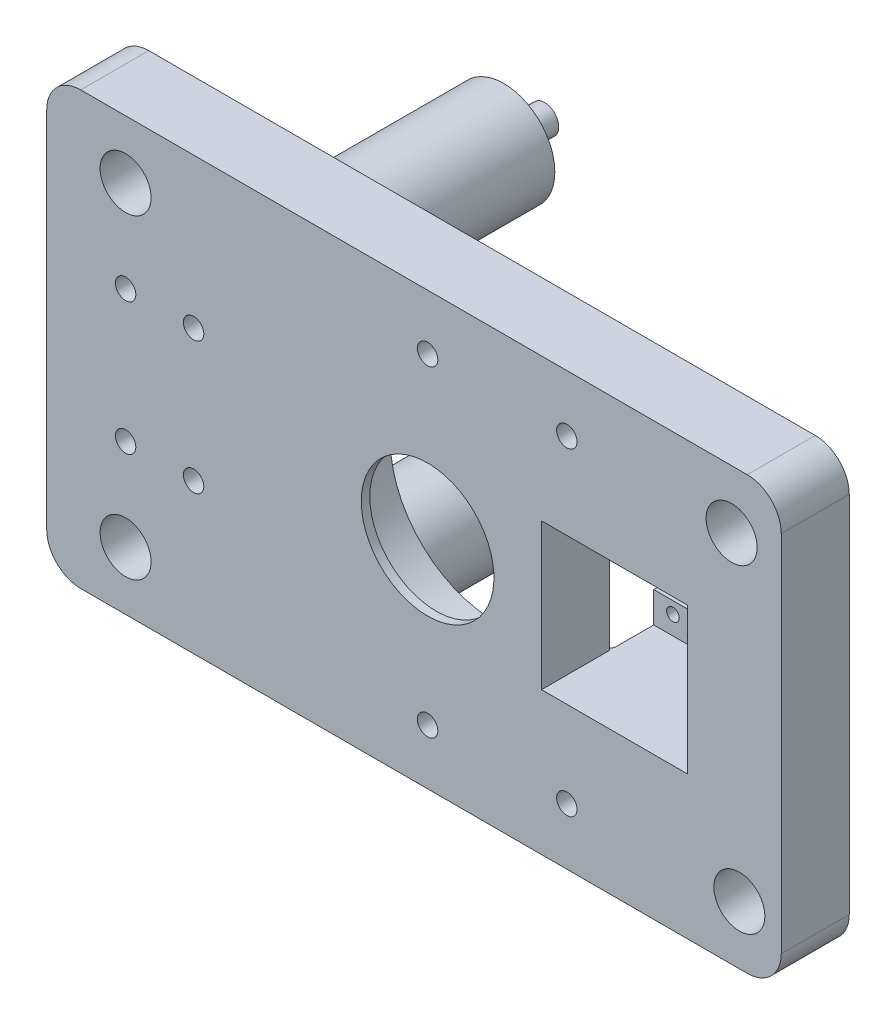
from build123d import *

# Parameters (mm, degrees)
SKETCH1_W            = 216
SKETCH1_H            = 127
BOSS_EXTRUDE1_DEPTH  = 20
FILLET1_R            = 10
FILLET2_R            = 10
SKETCH9_R            = 31
CUT_EXTRUDE4_DEPTH   = 17.5
SKETCH12_R           = 19.5
CUT_EXTRUDE5_DEPTH   = 127.500988138
SKETCH9_4_W          = 43
SKETCH9_4_H          = 43
CUT_EXTRUDE6_DEPTH   = 127.870997474
SKETCH13_W           = 43
SKETCH13_H           = 4
BOSS_EXTRUDE2_DEPTH  = 17
FILLET4_R            = 2
SKETCH17_W           = 43
SKETCH17_H           = 4
BOSS_EXTRUDE5_DEPTH  = 9
SKETCH18_W           = 43
SKETCH18_H           = 4
BOSS_EXTRUDE6_DEPTH  = 17
SKETCH19_W           = 43
SKETCH19_H           = 4
BOSS_EXTRUDE7_DEPTH  = 9
FILLET5_R            = 2
SKETCH20_R           = 1.85
CUT_EXTRUDE7_DEPTH   = 9
SKETCH23_R           = 1.85
CUT_EXTRUDE8_DEPTH   = 9
SKETCH25_R           = 15
BOSS_EXTRUDE9_DEPTH  = 48.84
SKETCH26_R           = 4.15
BOSS_EXTRUDE10_DEPTH = 12
SKETCH27_R           = 4.15
BOSS_EXTRUDE11_DEPTH = 12
FILLET9_R            = 2
FILLET10_R           = 2
SKETCH28_R           = 7.5
CUT_EXTRUDE9_DEPTH   = 150.101829633
SKETCH29_R           = 3
CUT_EXTRUDE11_DEPTH  = 140.275825612


with BuildPart() as part:
    # Sketch1 → Boss-Extrude1 (new body)
    with BuildSketch(Plane.XY):
        Rectangle(SKETCH1_W, SKETCH1_H)
    extrude(amount=BOSS_EXTRUDE1_DEPTH)

    # Fillet1
    fillet1_edges = [part.edges().sort_by_distance(p)[0] for p in [
        (-108, 63.5, 10),
    ]]
    fillet(fillet1_edges, radius=FILLET1_R)

    # Fillet2
    fillet2_edges = [part.edges().sort_by_distance(p)[0] for p in [
        (-108, -63.5, 10),
        (108, 63.5, 10),
        (108, -63.5, 10),
    ]]
    fillet(fillet2_edges, radius=FILLET2_R)

    # Sketch9 → Cut-Extrude4 (cut)
    with BuildSketch(Plane(origin=(0, 0, 0), x_dir=(-1, 0, 0), z_dir=(0, 0, -1))):
        with Locations((-4, 0)):
            Circle(SKETCH9_R)
    extrude(amount=-CUT_EXTRUDE4_DEPTH, mode=Mode.SUBTRACT)

    # Sketch12 → Cut-Extrude5 (cut, through all)
    with BuildSketch(Plane(origin=(0, 0, 17.5), x_dir=(-1, 0, 0), z_dir=(0, 0, -1))):
        with Locations((-4, 0)):
            Circle(SKETCH12_R)
    extrude(amount=-CUT_EXTRUDE5_DEPTH, mode=Mode.SUBTRACT)

    # Sketch9<4> → Cut-Extrude6 (cut, through all)
    with BuildSketch(Plane(origin=(0, 0, 0), x_dir=(-1, 0, 0), z_dir=(0, 0, -1))):
        with Locations((-59, 0)):
            Rectangle(SKETCH9_4_W, SKETCH9_4_H)
    extrude(amount=-CUT_EXTRUDE6_DEPTH, mode=Mode.SUBTRACT)

    # Sketch13 → Boss-Extrude2 (add)
    with BuildSketch(Plane(origin=(0, 0, 0), x_dir=(-1, 0, 0), z_dir=(0, 0, -1))):
        with Locations((-59, -23.5)):
            Rectangle(SKETCH13_W, SKETCH13_H)
    extrude(amount=BOSS_EXTRUDE2_DEPTH)

    # Fillet4
    fillet4_edges = [part.edges().sort_by_distance(p)[0] for p in [
        (59, -25.5, 0),
        (37.5, -23.5, 0),
        (80.5, -23.5, 0),
    ]]
    fillet(fillet4_edges, radius=FILLET4_R)

    # Sketch17 → Boss-Extrude5 (add)
    with BuildSketch(Plane(origin=(0, -21.5, 0), x_dir=(1, 0, 0), z_dir=(0, 1, 0))):
        with Locations((59, 15)):
            Rectangle(SKETCH17_W, SKETCH17_H)
    extrude(amount=BOSS_EXTRUDE5_DEPTH)

    # Sketch18 → Boss-Extrude6 (add)
    with BuildSketch(Plane(origin=(0, 0, 0), x_dir=(-1, 0, 0), z_dir=(0, 0, -1))):
        with Locations((-59, 23.5)):
            Rectangle(SKETCH18_W, SKETCH18_H)
    extrude(amount=BOSS_EXTRUDE6_DEPTH)

    # Sketch19 → Boss-Extrude7 (add)
    with BuildSketch(Plane(origin=(0, 21.5, 0), x_dir=(-1, 0, 0), z_dir=(0, -1, 0))):
        with Locations((-59, 15)):
            Rectangle(SKETCH19_W, SKETCH19_H)
    extrude(amount=BOSS_EXTRUDE7_DEPTH)

    # Fillet5
    fillet5_edges = [part.edges().sort_by_distance(p)[0] for p in [
        (37.5, 23.5, 0),
        (80.5, 23.5, 0),
        (59, 25.5, 0),
    ]]
    fillet(fillet5_edges, radius=FILLET5_R)

    # Sketch20 → Cut-Extrude7 (cut)
    with BuildSketch(Plane(origin=(0, 0, -17), x_dir=(-1, 0, 0), z_dir=(0, 0, -1))):
        with Locations((-43.15, -16)):
            Circle(SKETCH20_R)
        with Locations((-74.85, -16)):
            Circle(SKETCH20_R)
    extrude(amount=-CUT_EXTRUDE7_DEPTH, mode=Mode.SUBTRACT)

    # Sketch23 → Cut-Extrude8 (cut)
    with BuildSketch(Plane(origin=(0, 0, -17), x_dir=(-1, 0, 0), z_dir=(0, 0, -1))):
        with Locations((-43.15, 15.85)):
            Circle(SKETCH23_R)
        with Locations((-74.85, 16)):
            Circle(SKETCH23_R)
    extrude(amount=-CUT_EXTRUDE8_DEPTH, mode=Mode.SUBTRACT)

    # Sketch25 → Boss-Extrude9 (add)
    with BuildSketch(Plane(origin=(0, 0, 0), x_dir=(-1, 0, 0), z_dir=(0, 0, -1))):
        with Locations((42.424121096, -43.5)):
            Circle(SKETCH25_R)
        with Locations((42.424121096, 43.5)):
            Circle(SKETCH25_R)
    extrude(amount=BOSS_EXTRUDE9_DEPTH)

    # Sketch26 → Boss-Extrude10 (add)
    with BuildSketch(Plane(origin=(0, 0, -48.84), x_dir=(-1, 0, 0), z_dir=(0, 0, -1))):
        with Locations((42.424121096, -43.5)):
            Circle(SKETCH26_R)
    extrude(amount=BOSS_EXTRUDE10_DEPTH)

    # Sketch27 → Boss-Extrude11 (add)
    with BuildSketch(Plane(origin=(0, 0, -48.84), x_dir=(-1, 0, 0), z_dir=(0, 0, -1))):
        with Locations((42.424121096, 43.5)):
            Circle(SKETCH27_R)
    extrude(amount=BOSS_EXTRUDE11_DEPTH)

    # Fillet9
    fillet9_edges = [part.edges().sort_by_distance(p)[0] for p in [
        (-27.424121096, -43.5, 0),
    ]]
    fillet(fillet9_edges, radius=FILLET9_R)

    # Fillet10
    fillet10_edges = [part.edges().sort_by_distance(p)[0] for p in [
        (-27.424121096, 43.5, 0),
    ]]
    fillet(fillet10_edges, radius=FILLET10_R)

    # Sketch28 → Cut-Extrude9 (cut, through all)
    with BuildSketch(Plane.XY.offset(20)):
        with Locations((-84.811667967, 46.37)):
            Circle(SKETCH28_R)
        with Locations((-84.811667967, -46.37)):
            Circle(SKETCH28_R)
        with Locations((95.674047271, -46.369786546)):
            Circle(SKETCH28_R)
        with Locations((93.399057455, 46.37)):
            Circle(SKETCH28_R)
    extrude(amount=-CUT_EXTRUDE9_DEPTH, mode=Mode.SUBTRACT)

    # Sketch29 → Cut-Extrude11 (cut, through all)
    with BuildSketch(Plane(origin=(0, 0, 0), x_dir=(-1, 0, 0), z_dir=(0, 0, -1))):
        with Locations((-44.949528727, 46.81)):
            Circle(SKETCH29_R)
        with Locations((-4, 47.25)):
            Circle(SKETCH29_R)
        with Locations((-4, -47.25)):
            Circle(SKETCH29_R)
        with Locations((-44.949528727, -46.81)):
            Circle(SKETCH29_R)
        with Locations((84.811667967, -19.435)):
            Circle(SKETCH29_R)
        with Locations((84.811667967, 19.435)):
            Circle(SKETCH29_R)
        with Locations((64.811667967, 19.435)):
            Circle(SKETCH29_R)
        with Locations((64.811667967, -19.435)):
            Circle(SKETCH29_R)
    extrude(amount=-CUT_EXTRUDE11_DEPTH, mode=Mode.SUBTRACT)


solid = part.part
